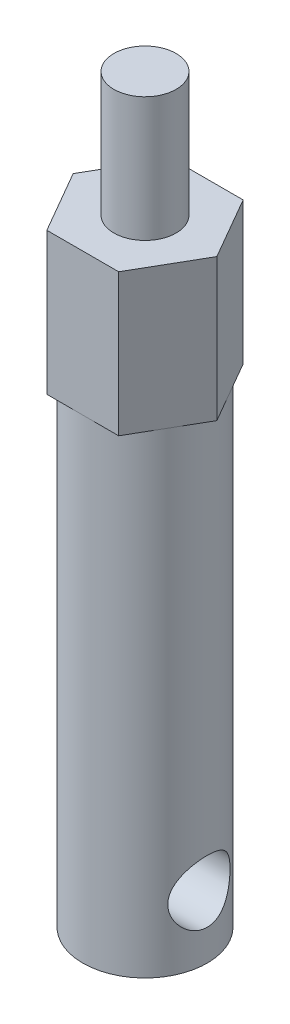
from build123d import *

# Parameters (mm, degrees)
SKETCH1_R               = 6.35
BOSS_EXTRUDE1_DEPTH     = 48.44415
BOSS_EXTRUDE2_DEPTH     = 14.499999936
CUT_EXTRUDE1_DEPTH      = 64.687140339
CUT_EXTRUDE1_DEPTH_BACK = 64.687140339
SKETCH4_R               = 3.175
SKETCH5_R               = 3.175
BOSS_EXTRUDE3_DEPTH     = 12.7


with BuildPart() as part:
    # Sketch1 → Boss-Extrude1 (new body)
    with BuildSketch(Plane(origin=(0, 0, 0), x_dir=(1, 0, 0), z_dir=(0, 1, 0))):
        Circle(SKETCH1_R)
    extrude(amount=BOSS_EXTRUDE1_DEPTH)

    # Sketch2 → Boss-Extrude2 (add)
    with BuildSketch(Plane(origin=(0, 48.44415, 0), x_dir=(1, 0, 0), z_dir=(0, 1, 0))):
        Polygon((7.332348419, 0), (3.666174209, 6.35), (-3.666174209, 6.35), (-7.332348419, 0), (-3.666174209, -6.35), (3.666174209, -6.35), align=None)
    extrude(amount=BOSS_EXTRUDE2_DEPTH)

    # Sketch4 → Cut-Extrude1 (cut, two sides: drawn at the far end of the back side and taken through both)
    with BuildSketch(Plane(origin=(0, 0, 0), x_dir=(0, 0, -1), z_dir=(1, 0, 0)).offset(-CUT_EXTRUDE1_DEPTH_BACK)):
        with Locations((0, 6.35)):
            Circle(SKETCH4_R)
    extrude(amount=CUT_EXTRUDE1_DEPTH + CUT_EXTRUDE1_DEPTH_BACK, mode=Mode.SUBTRACT)

    # Sketch5 → Boss-Extrude3 (add)
    with BuildSketch(Plane(origin=(0, 62.944149936, 0), x_dir=(1, 0, 0), z_dir=(0, 1, 0))):
        Circle(SKETCH5_R)
    extrude(amount=BOSS_EXTRUDE3_DEPTH)


solid = part.part
